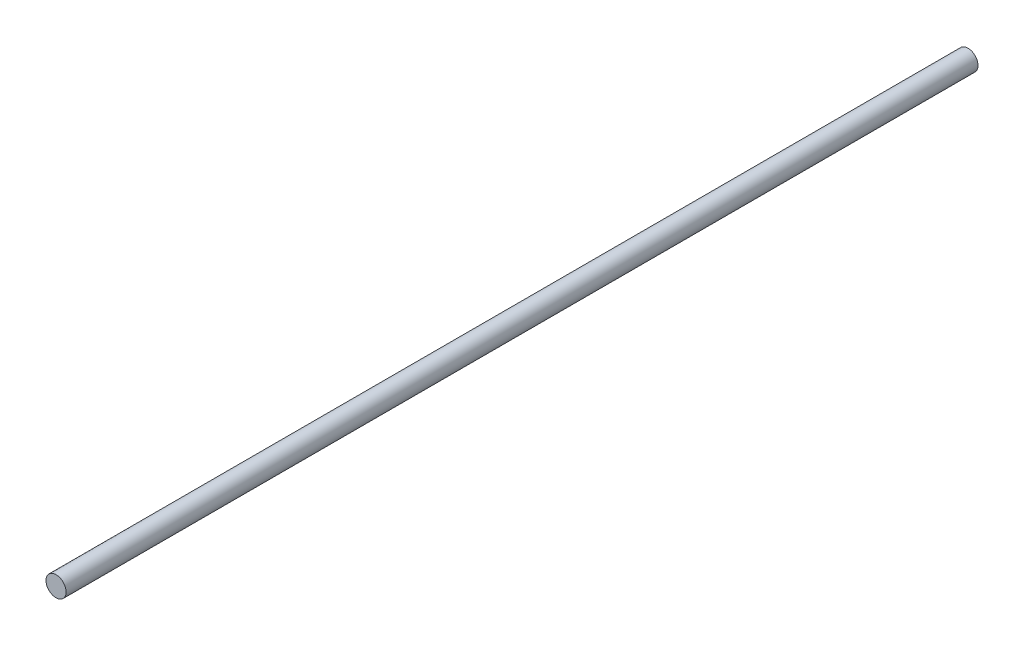
from build123d import *

# Parameters (mm, degrees)
SKETCH1_R           = 9.525
BOSS_EXTRUDE1_DEPTH = 863.6


with BuildPart() as part:
    # Sketch1 → Boss-Extrude1 (new body)
    with BuildSketch(Plane.XY):
        Circle(SKETCH1_R)
    extrude(amount=BOSS_EXTRUDE1_DEPTH)


solid = part.part
